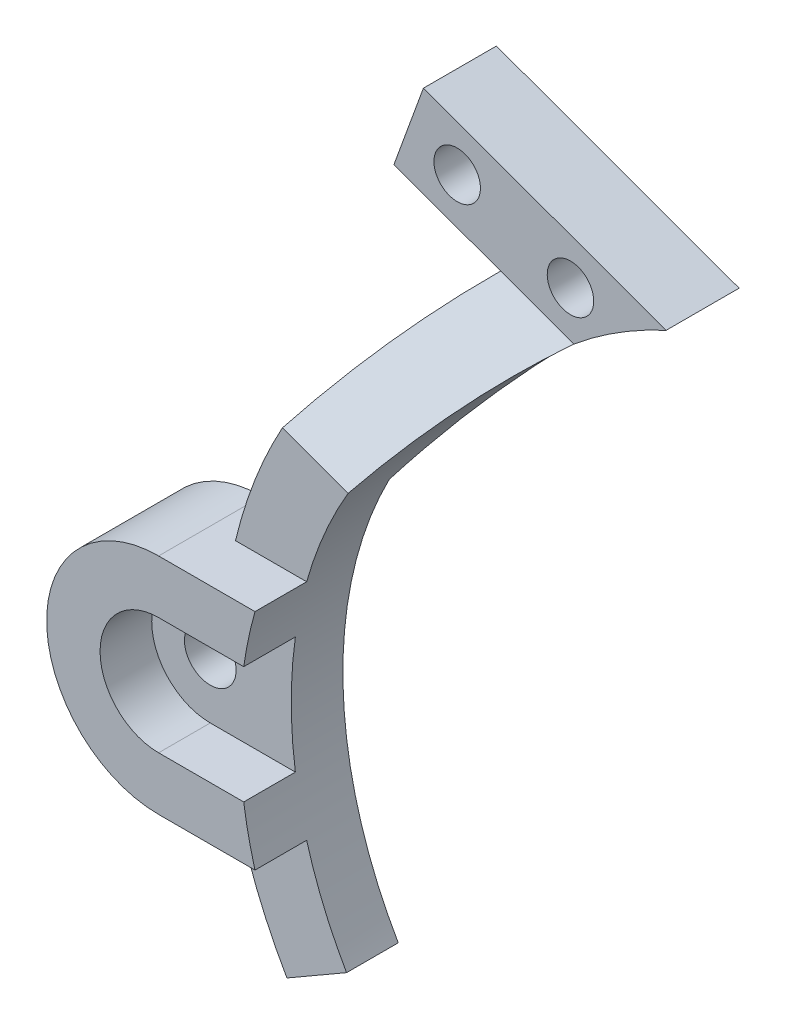
from build123d import *

# Parameters (mm, degrees)
RESSALTO_EXTRUS_O1_DEPTH   = 15
ESBO_O1_3_R                = 1.5
RESSALTO_EXTRUS_O2_DEPTH   = 12
ESBO_O1_4_R                = 1.35
RESSALTO_EXTRUS_O3_DEPTH   = 12
CORTE_EXTRUS_O1_DEPTH      = 38.511851967
CORTE_EXTRUS_O1_DEPTH_BACK = 38.511851967


with BuildPart() as part:
    # Esboço1 → Ressalto-extrusão1 (new body)
    with BuildSketch(Plane.XY):
        with BuildLine():
            ThreePointArc((0, -3.4), (-3.4, 0), (0, 3.4))
            Line((0, 3.4), (4.942053961, 3.4))
            ThreePointArc((4.942053961, 3.4), (5.218299225, 4.96081936), (5.596969896, 6.5))
            Line((5.596969896, 6.5), (1.464912337, 6.5))
            Line((1.464912337, 6.5), (0, 6.5))
            ThreePointArc((0, 6.5), (-6.5, 0), (0, -6.5))
            Line((0, -6.5), (1.464912337, -6.5))
            Line((1.464912337, -6.5), (5.596969896, -6.5))
            ThreePointArc((5.596969896, -6.5), (5.218299225, -4.96081936), (4.942053961, -3.4))
            Line((4.942053961, -3.4), (0, -3.4))
        make_face()
    extrude(amount=RESSALTO_EXTRUS_O1_DEPTH)

    # Esboço1<3> → Ressalto-extrusão2 (add)
    with BuildSketch(Plane.XY):
        with BuildLine():
            Line((4.942053961, 3.4), (0, 3.4))
            ThreePointArc((0, 3.4), (-3.4, 0), (0, -3.4))
            Line((0, -3.4), (4.942053961, -3.4))
            ThreePointArc((4.942053961, -3.4), (4.7, 0), (4.942053961, 3.4))
        make_face()
        Circle(ESBO_O1_3_R, mode=Mode.SUBTRACT)
    extrude(amount=RESSALTO_EXTRUS_O2_DEPTH)

    # Esboço1<4> → Ressalto-extrusão3 (add)
    # profile 1 of 2: a face of its own
    with BuildSketch(Plane.XY):
        with BuildLine():
            Line((1.464912337, 6.5), (5.596969896, 6.5))
            ThreePointArc((5.596969896, 6.5), (10.467155707, 15.606517517), (18.71318338, 21.823462003))
            Line((18.71318338, 21.823462003), (4.617794068, 26.953764153))
            Line((4.617794068, 26.953764153), (2.907693352, 22.255301049))
            Line((2.907693352, 22.255301049), (9.104082058, 20))
            ThreePointArc((9.104082058, 20), (4.330997733, 13.789551425), (1.464912337, 6.5))
        make_face()
        with Locations((6.581821572, 23.578472171)):
            Circle(ESBO_O1_4_R, mode=Mode.SUBTRACT)
        with Locations((13.159669918, 21.184331168)):
            Circle(ESBO_O1_4_R, mode=Mode.SUBTRACT)
    # profile 2 of 2: a face of its own
    with BuildSketch(Plane.XY):
        with BuildLine():
            ThreePointArc((7.915390309, -12), (6.584536367, -9.322353153), (5.596969896, -6.5))
            Line((5.596969896, -6.5), (1.464912337, -6.5))
            ThreePointArc((1.464912337, -6.5), (2.686390311, -10.358190524), (4.451288694, -14))
            Line((4.451288694, -14), (7.915390309, -12))
        make_face()
    extrude(amount=RESSALTO_EXTRUS_O3_DEPTH)

    # Esboço2 → Corte-extrusão1 (cut, two sides: drawn at the far end of the back side and taken through both)
    with BuildSketch(Plane(origin=(-4.585158039, 1.668861046, 0), x_dir=(0, 0, 1), z_dir=(-0.9396926207859106, 0.34202014332566283, 0)).offset(-CORTE_EXTRUS_O1_DEPTH_BACK)):
        Polygon((0, -11.633266294), (9, -11.633266294), (9, 12.907631866), (0, 21.907631866), align=None)
        Polygon((4.242640687, 26.907631866), (4.242640687, 21.907631866), (12, 14.150272553), (12, 26.907631866), align=None)
    extrude(amount=CORTE_EXTRUS_O1_DEPTH + CORTE_EXTRUS_O1_DEPTH_BACK, mode=Mode.SUBTRACT)


solid = part.part
